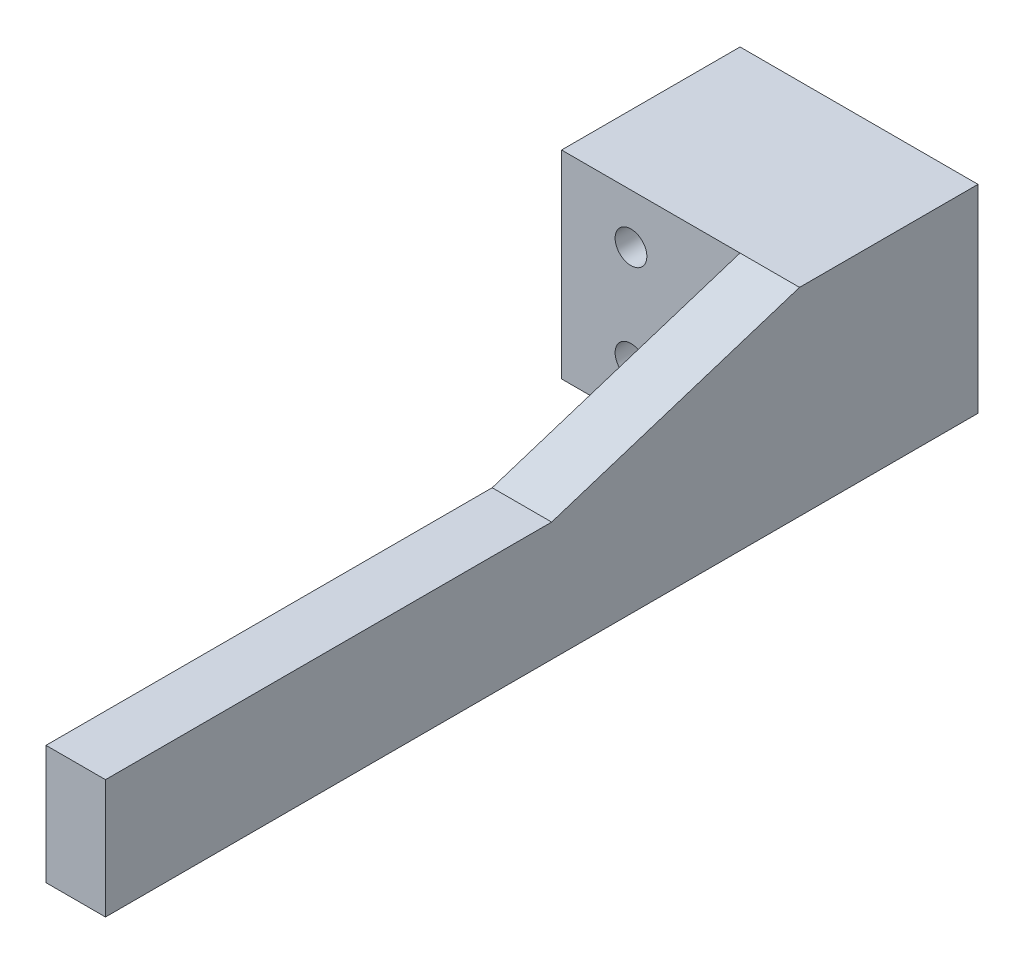
from build123d import *

# Parameters (mm, degrees)
SKETCH1_W           = 24
SKETCH1_H           = 20
SKETCH1_R           = 1.6
BOSS_EXTRUDE1_DEPTH = 18
BOSS_EXTRUDE2_DEPTH = 6
SKETCH3_R           = 2.5
BOSS_EXTRUDE3_DEPTH = 7
FILLET1_R           = 1
CHAMFER1_SIZE       = 2.5


with BuildPart() as part:
    # Sketch1 → Boss-Extrude1 (new body)
    with BuildSketch(Plane.XY):
        Rectangle(SKETCH1_W, SKETCH1_H)
        with Locations((-5, 5)):
            Circle(SKETCH1_R, mode=Mode.SUBTRACT)
        with Locations((-5, -5)):
            Circle(SKETCH1_R, mode=Mode.SUBTRACT)
    extrude(amount=BOSS_EXTRUDE1_DEPTH)

    # Sketch2 → Boss-Extrude2 (add)
    with BuildSketch(Plane(origin=(12, 0, 0), x_dir=(0, 0, -1), z_dir=(1, 0, 0))):
        Polygon((-18, -10), (-18, 10), (-43, 2), (-88, 2), (-88, -10), align=None)
    extrude(amount=-BOSS_EXTRUDE2_DEPTH)

    # Sketch3 → Boss-Extrude3 (add)
    with BuildSketch(Plane(origin=(0, -7.5, 0), x_dir=(-1, 0, 0), z_dir=(0, -1, 0))):
        with Locations((-6, -83)):
            Circle(SKETCH3_R)
        with Locations((-6, -65)):
            Circle(SKETCH3_R)
    extrude(amount=-BOSS_EXTRUDE3_DEPTH)

    # Fillet1
    fillet1_edges = [part.edges().sort_by_distance(p)[0] for p in [
        (6, -4, 80.5),
        (6, -4, 85.5),
        (6, -4, 62.5),
        (6, -4, 67.5),
    ]]
    fillet(fillet1_edges, radius=FILLET1_R)

    # Chamfer1
    chamfer1_edges = [part.edges().sort_by_distance(p)[0] for p in [
        (6, -0.5, 83),
    ]]
    chamfer(chamfer1_edges, length=CHAMFER1_SIZE - 0.0001)  # a hair under: the kernel refuses the full size
    chamfer1_2_edges = [part.edges().sort_by_distance(p)[0] for p in [
        (6, -7.5, 83),
    ]]
    chamfer(chamfer1_2_edges, length=CHAMFER1_SIZE - 0.0001)  # a hair under: the kernel refuses the full size
    chamfer1_3_edges = [part.edges().sort_by_distance(p)[0] for p in [
        (6, -0.5, 65),
    ]]
    chamfer(chamfer1_3_edges, length=CHAMFER1_SIZE - 0.0001)  # a hair under: the kernel refuses the full size
    chamfer1_4_edges = [part.edges().sort_by_distance(p)[0] for p in [
        (6, -7.5, 65),
    ]]
    chamfer(chamfer1_4_edges, length=CHAMFER1_SIZE - 0.0001)  # a hair under: the kernel refuses the full size


solid = part.part
